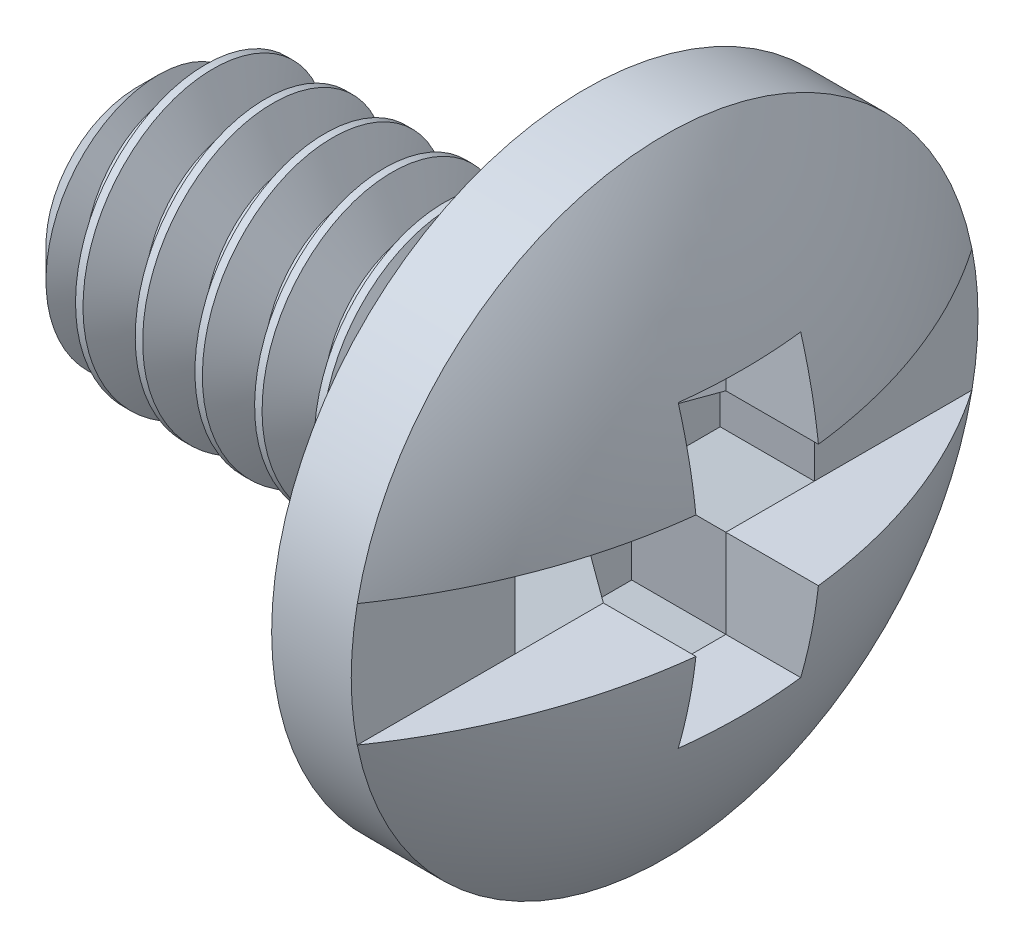
from build123d import *

# Parameters (mm, degrees)
SKETCH2_R                    = 2.413
BOSS_EXTRUDE1_DEPTH          = 7.9375
CHAMFER1_SIZE                = 0.79375
SKETCH17_W                   = 11.1125
SKETCH17_H                   = 2.1717
CUT_EXTRUDE5_DEPTH           = 1.763889
SKETCH18_W                   = 2.1717
SKETCH18_H                   = 5.3086
CUT_EXTRUDE6_DEPTH           = 13.212303543
CUT_EXTRUDE6_OTHER_WAY_DEPTH = 1.058333
CUT_EXTRUDE6_OTHER_WAY_TAPER = 30
SKETCH19_W                   = 5.3086
SKETCH19_H                   = 2.1717
CUT_EXTRUDE7_DEPTH           = 1.058333
CUT_EXTRUDE7_DRAFT           = -30
CUT_SWEEP1_PITCH             = 1.058333333
CUT_SWEEP1_TO                = 7.9375


with BuildPart() as part:
    # Sketch2 → Boss-Extrude1 (new body)
    with BuildSketch(Plane(origin=(0, 0, 0), x_dir=(0, 0, -1), z_dir=(1, 0, 0))):
        Circle(SKETCH2_R)
    extrude(amount=BOSS_EXTRUDE1_DEPTH)

    # Chamfer1
    chamfer1_edges = [part.edges().sort_by_distance(p)[0] for p in [
        (0, 0, 2.413),
    ]]
    chamfer(chamfer1_edges, length=CHAMFER1_SIZE)

    # Cut-Sweep1: arcs per turn and ends read off the stored shape
    # Cut-Sweep1: the profile of Sketch5 profile screwed along a right-hand helix through 8.5 turns, 8 arcs to a turn; built about Z, then put on its axis
    cut_sweep1_z = Axis((0, 0, 0), (0, 0, 1))
    cut_sweep1_corners = [(2.4133, 0, 0.000173205), (2.4133, 0, -0.926214872), (1.725592336, 0, -0.529166667), (1.725592336, 0, -0.396875)]
    with BuildLine(mode=Mode.PRIVATE) as cut_sweep1_profile:
        Line(cut_sweep1_corners[0], cut_sweep1_corners[1])
        Line(cut_sweep1_corners[1], cut_sweep1_corners[2])
        Line(cut_sweep1_corners[2], cut_sweep1_corners[3])
        Line(cut_sweep1_corners[3], cut_sweep1_corners[0])
    cut_sweep1_cap = Face(cut_sweep1_profile.wire())
    cut_sweep1_turn_angles = [0, 22.5, 45, 67.5, 90, 112.5, 135, 157.5, 180, 202.5, 225, 247.5, 270, 292.5, 315, 337.5, 360]
    cut_sweep1_turn_weights = [1, 0.9238795325112867, 1, 0.9238795325112867, 1, 0.9238795325112867, 1, 0.9238795325112867, 1, 0.9238795325112867, 1, 0.9238795325112867, 1, 0.9238795325112867, 1, 0.9238795325112867, 1]
    cut_sweep1_turn_rails = [Edge.make_bspline([Vector(p[0], p[1], 0).rotate(cut_sweep1_z, cut_sweep1_turn_angles[k]) / cut_sweep1_turn_weights[k] + Vector(0, 0, p[2] + CUT_SWEEP1_PITCH * cut_sweep1_turn_angles[k] / 360) for k in range(17)], [0, 0, 0, 1, 1, 2, 2, 3, 3, 4, 4, 5, 5, 6, 6, 7, 7, 8, 8, 8], 2, cut_sweep1_turn_weights) for p in cut_sweep1_corners]
    cut_sweep1_turn_sides = [Face.make_surface_from_curves(cut_sweep1_turn_rails[p[0]], cut_sweep1_turn_rails[p[1]]) for p in [(0, 1), (1, 2), (2, 3), (3, 0)]]
    cut_sweep1_last_angles = [2880, 2902.5, 2925, 2947.5, 2970, 2992.5, 3015, 3037.5, 3060]
    cut_sweep1_last_weights = [1, 0.9238795325112867, 1, 0.9238795325112867, 1, 0.9238795325112867, 1, 0.9238795325112822, 1]
    cut_sweep1_last_rails = [Edge.make_bspline([Vector(p[0], p[1], 0).rotate(cut_sweep1_z, cut_sweep1_last_angles[k]) / cut_sweep1_last_weights[k] + Vector(0, 0, p[2] + CUT_SWEEP1_PITCH * cut_sweep1_last_angles[k] / 360) for k in range(9)], [0, 0, 0, 1, 1, 2, 2, 3, 3, 4, 4, 4], 2, cut_sweep1_last_weights) for p in cut_sweep1_corners]
    cut_sweep1_last_sides = [Face.make_surface_from_curves(cut_sweep1_last_rails[p[0]], cut_sweep1_last_rails[p[1]]) for p in [(0, 1), (1, 2), (2, 3), (3, 0)]]
    cut_sweep1 = Plane(origin=(0, 0, 0), x_dir=(0, 1, 0), z_dir=(1, 0, 0)) * split(Solid(Shell([*[p.moved(Location((0, 0, CUT_SWEEP1_PITCH * i))) for i in range(8) for p in cut_sweep1_turn_sides], *cut_sweep1_last_sides, cut_sweep1_cap, cut_sweep1_cap.rotate(cut_sweep1_z, 3060).moved(Location((0, 0, CUT_SWEEP1_PITCH * 3060 / 360)))])), bisect_by=Plane.XY.offset(CUT_SWEEP1_TO), keep=Keep.BOTTOM, mode=Mode.PRIVATE)
    add(cut_sweep1, mode=Mode.SUBTRACT)


with BuildPart() as body_2:
    # Sketch6 → Revolve1 (revolve)
    with BuildSketch(Plane.XY):
        with BuildLine():
            Line((7.9375, 0), (7.9375, 5.55625))
            Line((7.9375, 5.55625), (9.348611111, 5.55625))
            ThreePointArc((9.348611111, 5.55625), (10.660944275, 2.91475634), (11.1125, 0))
            Line((11.1125, 0), (7.9375, 0))
        make_face()
    revolve(axis=Axis((7.9375, 0, 0), (1, 0, 0)))

    # Sketch17 → Cut-Extrude5 (cut)
    with BuildSketch(Plane(origin=(11.1125, 0, 0), x_dir=(0, 0, -1), z_dir=(1, 0, 0))):
        Rectangle(SKETCH17_W, SKETCH17_H)
    extrude(amount=-CUT_EXTRUDE5_DEPTH, mode=Mode.SUBTRACT)

    # Sketch18 → Cut-Extrude6 (cut)
    with BuildSketch(Plane(origin=(9.348611111, 0, 0), x_dir=(0, 0, -1), z_dir=(1, 0, 0))):
        Rectangle(SKETCH18_W, SKETCH18_H)
    extrude(amount=CUT_EXTRUDE6_DEPTH, mode=Mode.SUBTRACT)

    # Sketch18 → Cut-Extrude6 other way (cut)
    with BuildSketch(Plane(origin=(9.348611111, 0, 0), x_dir=(0, 0, -1), z_dir=(1, 0, 0))):
        Rectangle(SKETCH18_W, SKETCH18_H)
    extrude(amount=-CUT_EXTRUDE6_OTHER_WAY_DEPTH, taper=CUT_EXTRUDE6_OTHER_WAY_TAPER, mode=Mode.SUBTRACT)


with BuildPart() as cut_extrude7_tool:
    # Sketch19 → Cut-Extrude7 (with draft: the straight prism first)
    with BuildSketch(Plane(origin=(9.348611111, 0, 0), x_dir=(0, 0, -1), z_dir=(1, 0, 0))):
        Rectangle(SKETCH19_W, SKETCH19_H)
    extrude(amount=-CUT_EXTRUDE7_DEPTH)
    # Cut-Extrude7: the draft: its side faces are tilted about the plane it starts from
    cut_extrude7_sides = [cut_extrude7_tool.faces().sort_by_distance(p)[0] for p in [
        (8.819444611, 0, 2.6543),
        (8.819444611, -1.08585, 0),
        (8.819444611, 0, -2.6543),
        (8.819444611, 1.08585, 0),
    ]]
    draft(cut_extrude7_sides, Plane(origin=(9.348611111, 0, 0), x_dir=(0, 0, -1), z_dir=(1, 0, 0)), CUT_EXTRUDE7_DRAFT)


with BuildPart() as body_2_1:
    add(body_2.part)

    # Cut-Extrude7: cut by cut_extrude7_tool
    add(cut_extrude7_tool.part, mode=Mode.SUBTRACT)

    # Combine1: union part
    add(part.part)


solid = body_2_1.part
